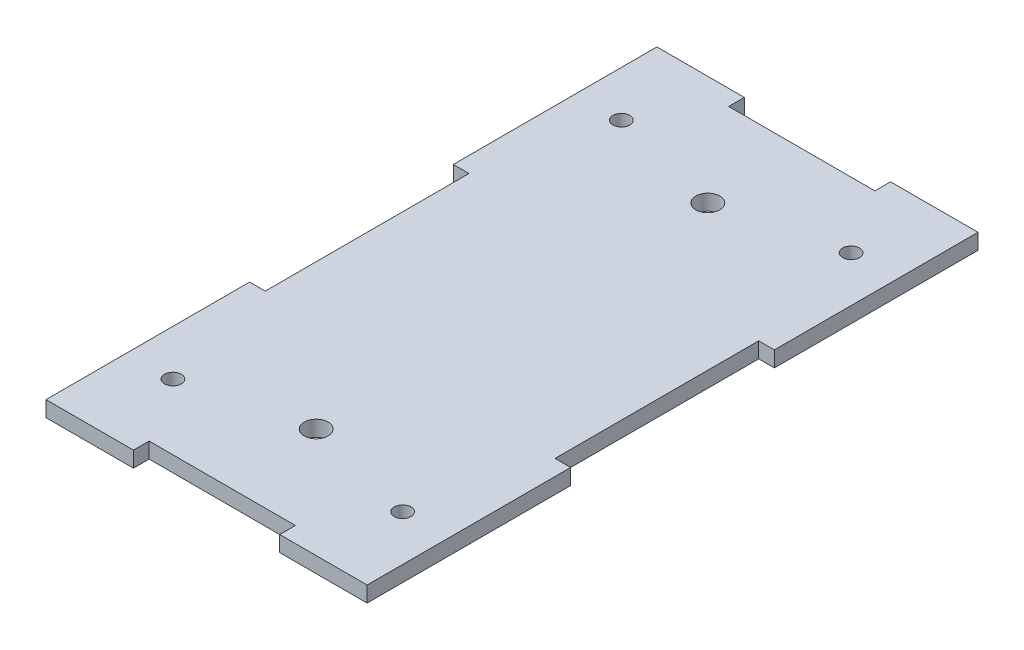
from build123d import *

# Parameters (mm, degrees)
SKETCH1_R           = 2.3
SKETCH1_R_2         = 1.609204822
BOSS_EXTRUDE1_DEPTH = 3


with BuildPart() as part:
    # Sketch1 → Boss-Extrude1 (new body)
    with BuildSketch(Plane(origin=(0, 0, 0), x_dir=(1, 0, 0), z_dir=(0, 1, 0))):
        Polygon((-30.75, 58.5), (-30.75, 19.5), (-27.75, 19.5), (-27.75, -19.5), (-30.75, -19.5), (-30.75, -58.5), (-14, -58.5), (-14, -55.5), (14, -55.5), (14, -58.5), (30.75, -58.5), (30.75, -19.5), (27.75, -19.5), (27.75, 19.5), (30.75, 19.5), (30.75, 58.5), (14, 58.5), (14, 55.5), (-14, 55.5), (-14, 58.5), align=None)
        with Locations((0, 37.5)):
            Circle(SKETCH1_R, mode=Mode.SUBTRACT)
        with Locations((0, -37.5)):
            Circle(SKETCH1_R, mode=Mode.SUBTRACT)
        with Locations((-22, -42.94)):
            Circle(SKETCH1_R_2, mode=Mode.SUBTRACT)
        with Locations((22, -42.94)):
            Circle(SKETCH1_R_2, mode=Mode.SUBTRACT)
        with Locations((22, 42.94)):
            Circle(SKETCH1_R_2, mode=Mode.SUBTRACT)
        with Locations((-22, 42.94)):
            Circle(SKETCH1_R_2, mode=Mode.SUBTRACT)
    extrude(amount=BOSS_EXTRUDE1_DEPTH)


solid = part.part
